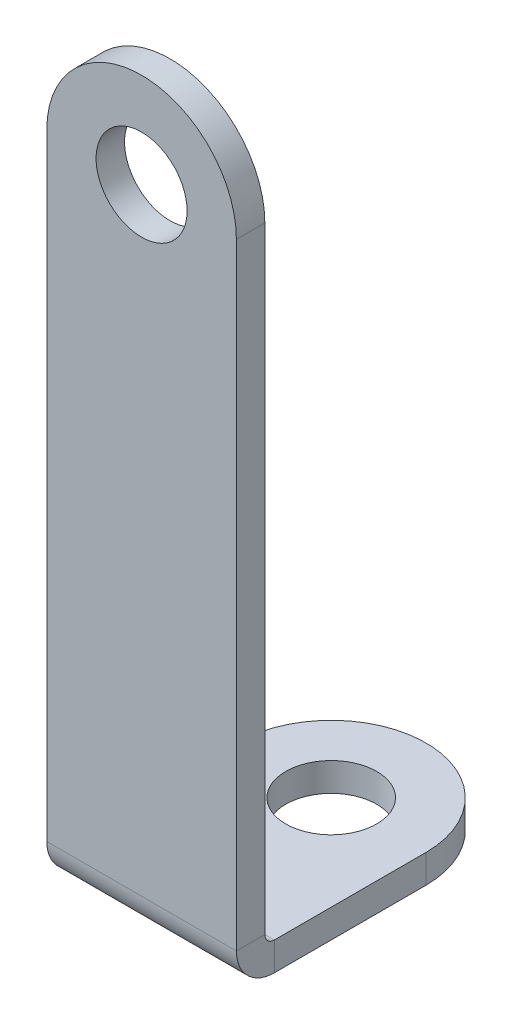
from build123d import *

# Parameters (mm, degrees)
BASE_FLANGE1_DEPTH       = 2.5
FILLET1_RADIUS           = 2.5
FILLET1_LENGTH           = 0.75
FILLET2_RADIUS           = 2.5
FILLET2_LENGTH           = 0.75
M2_CLEARANCE_HOLE1_D     = 2.4
M2_CLEARANCE_HOLE1_DEPTH = 6
M2_CLEARANCE_HOLE1_TIP   = 0.721032743
M2_CLEARANCE_HOLE2_D     = 2.4
M2_CLEARANCE_HOLE2_DEPTH = 6
M2_CLEARANCE_HOLE2_TIP   = 0.721032743


# Sheet-metal steps are written as plain solids
with BuildPart() as part:
    # Sketch1 → Base-Flange1 (new, symmetric)
    with BuildSketch(Plane(origin=(0, 0, 0), x_dir=(0, 0, -1), z_dir=(1, 0, 0))):
        with BuildLine():
            Line((0, 19.75), (0, 1))
            ThreePointArc((0, 1), (0.292893219, 0.292893219), (1, 0))
            Line((1, 0), (7.5, 0))
            Line((7.5, 0), (7.5, 0.75))
            Line((7.5, 0.75), (1, 0.75))
            ThreePointArc((1, 0.75), (0.823223305, 0.823223305), (0.75, 1))
            Line((0.75, 1), (0.75, 19.75))
            Line((0.75, 19.75), (0, 19.75))
        make_face()
    extrude(amount=BASE_FLANGE1_DEPTH, both=True)

    # Fillet1: full round fillet: the end face becomes a half cylinder, R = half its width
    fillet1_face = Plane((0, 0.375, -7.5), x_dir=(0, -1, 0), z_dir=(0, 0, -1))  # on the end face: x along it, z out of the body
    fillet1_slab = fillet1_face.offset(-FILLET1_RADIUS / 2) * Box(FILLET1_LENGTH, 2 * FILLET1_RADIUS, FILLET1_RADIUS, mode=Mode.PRIVATE)  # the body's end, R deep
    fillet1_round = Plane((0, 0.375, -5), x_dir=(0, 0, -1), z_dir=(0, -1, 0)) * Cylinder(FILLET1_RADIUS, FILLET1_LENGTH, mode=Mode.PRIVATE)  # its axis R under the face
    add(fillet1_slab - fillet1_round, mode=Mode.SUBTRACT)

    # Fillet2: full round fillet: the end face becomes a half cylinder, R = half its width
    fillet2_face = Plane((0, 19.75, -0.375), x_dir=(0, 0, -1), z_dir=(0, 1, 0))  # on the end face: x along it, z out of the body
    fillet2_slab = fillet2_face.offset(-FILLET2_RADIUS / 2) * Box(FILLET2_LENGTH, 2 * FILLET2_RADIUS, FILLET2_RADIUS, mode=Mode.PRIVATE)  # the body's end, R deep
    fillet2_round = Plane((0, 17.25, -0.375), x_dir=(0, 1, 0), z_dir=(0, 0, -1)) * Cylinder(FILLET2_RADIUS, FILLET2_LENGTH, mode=Mode.PRIVATE)  # its axis R under the face
    add(fillet2_slab - fillet2_round, mode=Mode.SUBTRACT)

    # M2 Clearance Hole1
    with Locations(Plane.XY):
        with Locations((0, 17.25)):
            Hole(M2_CLEARANCE_HOLE1_D / 2, depth=M2_CLEARANCE_HOLE1_DEPTH)
            with Locations((0, 0, -(M2_CLEARANCE_HOLE1_DEPTH + M2_CLEARANCE_HOLE1_TIP / 2))):  # 118° drill point
                Cone(0, M2_CLEARANCE_HOLE1_D / 2, M2_CLEARANCE_HOLE1_TIP, mode=Mode.SUBTRACT)

    # M2 Clearance Hole2
    with Locations(Plane(origin=(0, 0.75, 0), x_dir=(1, 0, 0), z_dir=(0, 1, 0))):
        with Locations((0, 5)):
            Hole(M2_CLEARANCE_HOLE2_D / 2, depth=M2_CLEARANCE_HOLE2_DEPTH)
            with Locations((0, 0, -(M2_CLEARANCE_HOLE2_DEPTH + M2_CLEARANCE_HOLE2_TIP / 2))):  # 118° drill point
                Cone(0, M2_CLEARANCE_HOLE2_D / 2, M2_CLEARANCE_HOLE2_TIP, mode=Mode.SUBTRACT)


solid = part.part
